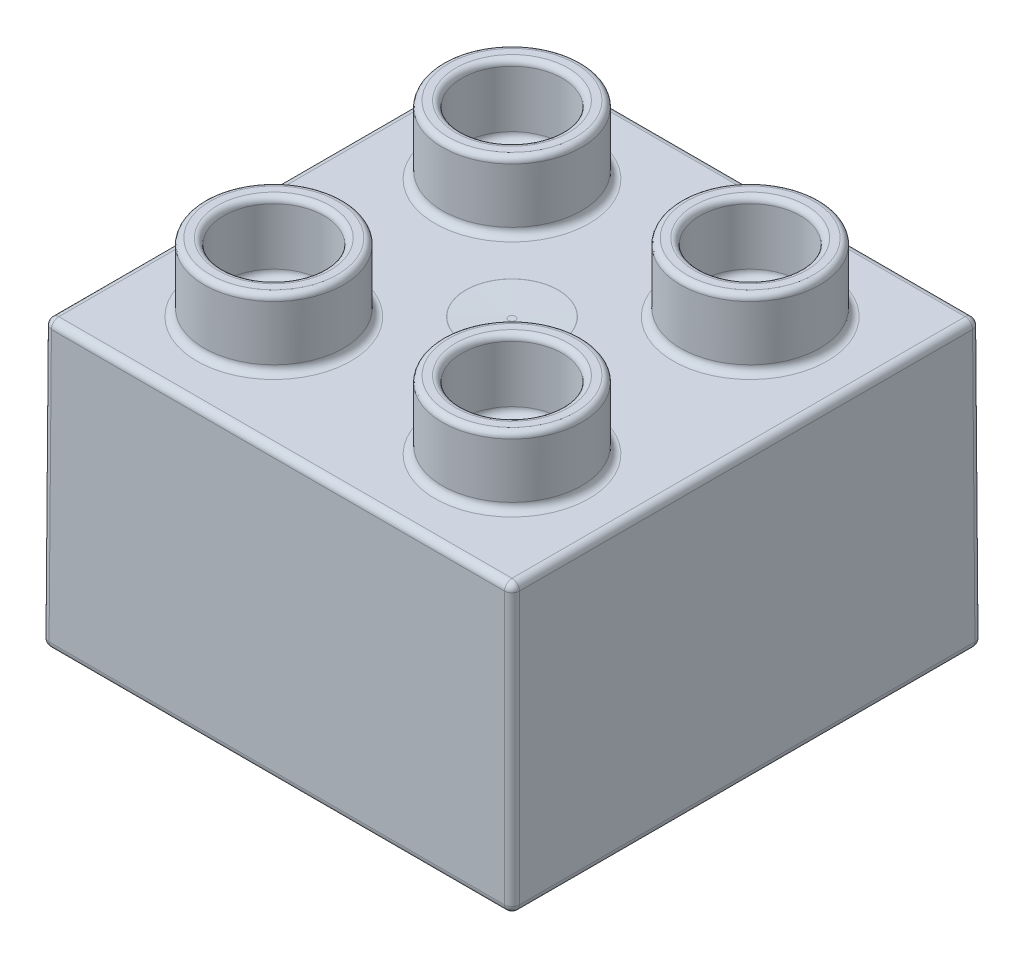
from build123d import *

# Parameters (mm, degrees)
SKETCH1_W           = 31.6
SKETCH1_H           = 31.6
BOSS_EXTRUDE1_DEPTH = 19.17
BOSS_EXTRUDE1_TAPER = 0.25
SKETCH2_R           = 4.675
BOSS_EXTRUDE2_DEPTH = 4.58
SKETCH3_R           = 6.638708499
CUT_EXTRUDE1_DEPTH  = 5.5
SKETCH4_R           = 6.638708499
CUT_EXTRUDE2_DEPTH  = 2
SKETCH5_R           = 3.375
CUT_EXTRUDE3_DEPTH  = 4.7
SKETCH6_R           = 5.338708499
CUT_EXTRUDE4_DEPTH  = 16
SKETCH7_W           = 28.4
SKETCH7_H           = 28.4
SKETCH7_R           = 6.638708499
CUT_EXTRUDE5_DEPTH  = 17.8
SKETCH9_W           = 1
SKETCH9_H           = 1.7
SKETCH9_W_2         = 1.7
SKETCH9_H_2         = 1
EXTRUDE_THIN1_DEPTH = 17.8
SKETCH10_W          = 9.161291501
SKETCH10_H          = 1
EXTRUDE_THIN2_DEPTH = 13.3
SKETCH12_R          = 3.24
CUT_EXTRUDE6_DEPTH  = 0.1
CHAMFER1_SIZE       = 0.104762308
CHAMFER1_SIZE_2     = 3
FILLET2_R           = 0.5
FILLET4_R           = 0.4


with BuildPart() as part:
    # Sketch1 → Boss-Extrude1 (new body)
    with BuildSketch(Plane(origin=(0, 0, 0), x_dir=(1, 0, 0), z_dir=(0, 1, 0))):
        with Locations((15.8, 15.8)):
            Rectangle(SKETCH1_W, SKETCH1_H)
    extrude(amount=BOSS_EXTRUDE1_DEPTH, taper=BOSS_EXTRUDE1_TAPER)

    # Sketch2 → Boss-Extrude2 (add)
    with BuildSketch(Plane(origin=(0, 19.17, 0), x_dir=(1, 0, 0), z_dir=(0, 1, 0))):
        with Locations(Location((7.8, 23.8, 0), (0, 0, 90))):
            Circle(SKETCH2_R)
        with Locations(Location((23.8, 7.8, 0), (0, 0, 90))):
            Circle(SKETCH2_R)
        with Locations(Location((7.8, 7.8, 0), (0, 0, 90))):
            Circle(SKETCH2_R)
        with Locations(Location((23.8, 23.8, 0), (0, 0, 90))):
            Circle(SKETCH2_R)
    extrude(amount=BOSS_EXTRUDE2_DEPTH)

    # Sketch3 → Cut-Extrude1 (cut)
    with BuildSketch(Plane.XZ):
        Polygon((6.8, -3.125), (8.8, -3.125), (9.425, -2.5), (22.175, -2.5), (22.8, -3.125), (24.8, -3.125), (25.425, -2.5), (29.1, -2.5), (29.1, -6.175), (28.475, -6.8), (28.475, -8.8), (29.1, -9.425), (29.1, -22.175), (28.475, -22.8), (28.475, -24.8), (29.1, -25.425), (29.1, -29.1), (25.425, -29.1), (24.8, -28.475), (22.8, -28.475), (22.175, -29.1), (9.425, -29.1), (8.8, -28.475), (6.8, -28.475), (6.175, -29.1), (2.5, -29.1), (2.5, -25.425), (3.125, -24.8), (3.125, -22.8), (2.5, -22.175), (2.5, -9.425), (3.125, -8.8), (3.125, -6.8), (2.5, -6.175), (2.5, -2.5), (6.175, -2.5), align=None)
        with Locations(Location((15.8, -15.8, 0), (0, 0, 270))):
            Circle(SKETCH3_R, mode=Mode.SUBTRACT)
    extrude(amount=-CUT_EXTRUDE1_DEPTH, mode=Mode.SUBTRACT)

    # Sketch4 → Cut-Extrude2 (cut)
    with BuildSketch(Plane.XZ):
        with Locations(Location((15.8, -15.8, 0), (0, 0, 270))):
            Circle(SKETCH4_R)
    extrude(amount=-CUT_EXTRUDE2_DEPTH, mode=Mode.SUBTRACT)

    # Sketch5 → Cut-Extrude3 (cut)
    with BuildSketch(Plane(origin=(0, 23.75, 0), x_dir=(1, 0, 0), z_dir=(0, 1, 0))):
        with Locations(Location((7.8, 23.8, 0), (0, 0, 270))):
            Circle(SKETCH5_R)
        with Locations(Location((23.8, 23.8, 0), (0, 0, 270))):
            Circle(SKETCH5_R)
        with Locations(Location((7.8, 7.8, 0), (0, 0, 270))):
            Circle(SKETCH5_R)
        with Locations(Location((23.8, 7.8, 0), (0, 0, 270))):
            Circle(SKETCH5_R)
    extrude(amount=-CUT_EXTRUDE3_DEPTH, mode=Mode.SUBTRACT)

    # Sketch6 → Cut-Extrude4 (cut)
    with BuildSketch(Plane.XZ.offset(-2)):
        with Locations(Location((15.8, -15.8, 0), (0, 0, 270))):
            Circle(SKETCH6_R)
    extrude(amount=-CUT_EXTRUDE4_DEPTH, mode=Mode.SUBTRACT)

    # Sketch7 → Cut-Extrude5 (cut)
    with BuildSketch(Plane.XZ):
        with Locations((15.8, -15.8)):
            Rectangle(SKETCH7_W, SKETCH7_H)
        with Locations(Location((15.8, -15.8, 0), (0, 0, 270))):
            Circle(SKETCH7_R, mode=Mode.SUBTRACT)
    extrude(amount=-CUT_EXTRUDE5_DEPTH, mode=Mode.SUBTRACT)

    # Sketch9 → Extrude-Thin1 (add)
    with BuildSketch(Plane.XZ):
        with Locations((7.8, -2.45)):
            Rectangle(SKETCH9_W, SKETCH9_H)
        with Locations((23.8, -2.45)):
            Rectangle(SKETCH9_W, SKETCH9_H)
        with Locations((29.15, -7.8)):
            Rectangle(SKETCH9_W_2, SKETCH9_H_2)
        with Locations((29.15, -23.8)):
            Rectangle(SKETCH9_W_2, SKETCH9_H_2)
        with Locations((23.8, -29.15)):
            Rectangle(SKETCH9_W, SKETCH9_H)
        with Locations((7.8, -29.15)):
            Rectangle(SKETCH9_W, SKETCH9_H)
        with Locations((2.45, -23.8)):
            Rectangle(SKETCH9_W_2, SKETCH9_H_2)
        with Locations((2.45, -7.8)):
            Rectangle(SKETCH9_W_2, SKETCH9_H_2)
    extrude(amount=-EXTRUDE_THIN1_DEPTH)

    # Sketch10 → Extrude-Thin2 (add)
    with BuildSketch(Plane.XZ.offset(-17.8)):
        with Locations((5.080645751, -16.3)):
            Rectangle(SKETCH10_W, SKETCH10_H)
        with Locations((26.51935425, -15.3)):
            Rectangle(SKETCH10_W, SKETCH10_H)
    extrude(amount=EXTRUDE_THIN2_DEPTH)

    # Sketch12 → Cut-Extrude6 (cut)
    with BuildSketch(Plane(origin=(0, 19.17, 0), x_dir=(1, 0, 0), z_dir=(0, 1, 0))):
        with Locations(Location((15.8, 15.8, 0), (0, 0, 270))):
            Circle(SKETCH12_R)
    extrude(amount=-CUT_EXTRUDE6_DEPTH, mode=Mode.SUBTRACT)

    # Chamfer1
    # the kernel refuses this chamfer: 3, 0.104762308 mm, written as the material it adds along each edge
    with BuildSketch(Plane(origin=(15.8, 19.07, -15.8), x_dir=(0, 0, 1), z_dir=(-1, 0, 0))) as chamfer1_piece_1_section:
        Polygon((3.24, CHAMFER1_SIZE * 1.00000000454), (3.24 - CHAMFER1_SIZE_2, 0), (3.24, 0), align=None)
    chamfer1_piece_1 = revolve(axis=Axis((15.8, 19.07, -15.8), (0, 1, 0)), mode=Mode.PRIVATE)
    chamfer1_piece_1 = split(chamfer1_piece_1, bisect_by=Plane(origin=(15.8, 19.17, -17.412418994), z_dir=(0, -1, 0)), keep=Keep.TOP, mode=Mode.PRIVATE)
    add(chamfer1_piece_1)

    # Fillet2
    fillet2_edges = [part.edges().sort_by_distance(p)[0] for p in [
        (31.516354565, 19.17, -15.8),
        (7.8, 19.05, -27.175),
        (7.8, 19.05, -11.175),
        (23.8, 19.05, -11.175),
        (23.8, 19.05, -27.175),
        (7.8, 19.17, -19.125),
        (15.8, 19.17, -31.516354565),
        (23.8, 19.17, -3.125),
        (7.8, 19.17, -3.125),
        (23.8, 19.17, -19.125),
        (15.8, 19.17, -18.903625328),
        (0.083645435, 19.17, -15.8),
        (15.8, 0, -31.6),
        (31.6, 0, -15.8),
        (15.8, 0, 0),
        (0, 0, -15.8),
        (0.041822718, 9.585, -31.558177282),
        (31.558177282, 9.585, -31.558177282),
        (31.558177282, 9.585, -0.041822718),
        (0.041822718, 9.585, -0.041822718),
        (15.8, 19.17, -0.083645435),
    ]]
    fillet(fillet2_edges, radius=FILLET2_R)

    # Fillet4
    fillet4_edges = [part.edges().sort_by_distance(p)[0] for p in [
        (7.8, 23.75, -27.175),
        (7.8, 23.75, -11.175),
        (23.8, 23.75, -11.175),
        (23.8, 23.75, -27.175),
        (7.8, 23.75, -19.125),
        (23.8, 23.75, -3.125),
        (7.8, 23.75, -3.125),
        (23.8, 23.75, -19.125),
    ]]
    fillet(fillet4_edges, radius=FILLET4_R)


solid = part.part
